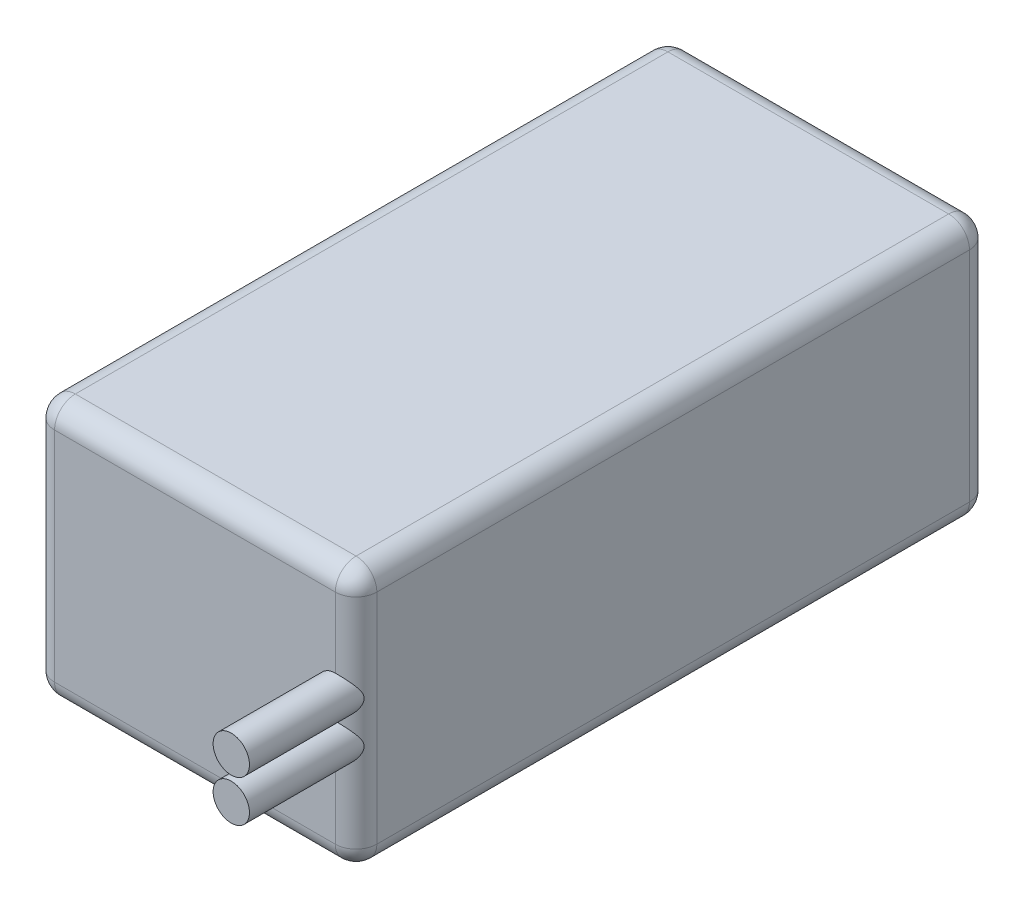
from build123d import *

# Parameters (mm, degrees)
SKETCH1_W           = 31
SKETCH1_H           = 61
BOSS_EXTRUDE1_DEPTH = 25
SKETCH2_R           = 1.75
BOSS_EXTRUDE2_DEPTH = 10
FILLET1_R           = 2


with BuildPart() as part:
    # Sketch1 → Boss-Extrude1 (new body)
    with BuildSketch(Plane(origin=(0, 0, 0), x_dir=(1, 0, 0), z_dir=(0, 1, 0))):
        Rectangle(SKETCH1_W, SKETCH1_H)
    extrude(amount=BOSS_EXTRUDE1_DEPTH)

    # Sketch2 → Boss-Extrude2 (add)
    with BuildSketch(Plane.XY.offset(30.5)):
        with Locations(Location((13.5, 14.5, 0), (0, 0, 180))):
            Circle(SKETCH2_R)
        with Locations((13.5, 10.5)):
            Circle(SKETCH2_R)
    extrude(amount=BOSS_EXTRUDE2_DEPTH)

    # Fillet1
    # the kernel refuses this fillet: 2 mm, written as the material it takes off along each edge
    with BuildSketch(Plane(origin=(-13.5, 23, 28.5), x_dir=(0, 1, 0), z_dir=(-1, 0, 0))) as fillet1_piece_1_section:
        Polygon((0, 0), (FILLET1_R, 0), (FILLET1_R, -FILLET1_R), (0, -FILLET1_R), align=None)
    fillet1_piece_1 = extrude(amount=FILLET1_R, mode=Mode.PRIVATE)
    fillet1_piece_1 = fillet1_piece_1 - Plane(origin=(-13.5, 23, 28.5), x_dir=(0, -0.7071067811865475, -0.7071067811865475), z_dir=(-1, 0, 0)) * Sphere(FILLET1_R, mode=Mode.PRIVATE)
    add(fillet1_piece_1, mode=Mode.SUBTRACT)
    with BuildSketch(Plane(origin=(-13.5, 23, -28.5), x_dir=(-1, 0, 0), z_dir=(0, 0, -1))) as fillet1_piece_2_section:
        Polygon((0, 0), (FILLET1_R, 0), (FILLET1_R, FILLET1_R), (0, FILLET1_R), align=None)
    fillet1_piece_2 = extrude(amount=FILLET1_R, mode=Mode.PRIVATE)
    fillet1_piece_2 = fillet1_piece_2 - Plane(origin=(-13.5, 23, -28.5), x_dir=(0.7071067811865475, -0.7071067811865475, 0), z_dir=(0, 0, -1)) * Sphere(FILLET1_R, mode=Mode.PRIVATE)
    add(fillet1_piece_2, mode=Mode.SUBTRACT)
    with BuildSketch(Plane(origin=(13.5, 23, 28.5), x_dir=(0, 1, 0), z_dir=(1, 0, 0))) as fillet1_piece_3_section:
        Polygon((0, 0), (FILLET1_R, 0), (FILLET1_R, FILLET1_R), (0, FILLET1_R), align=None)
    fillet1_piece_3 = extrude(amount=FILLET1_R, mode=Mode.PRIVATE)
    fillet1_piece_3 = fillet1_piece_3 - Plane(origin=(13.5, 23, 28.5), x_dir=(0, -0.7071067811865475, -0.7071067811865475), z_dir=(1, 0, 0)) * Sphere(FILLET1_R, mode=Mode.PRIVATE)
    add(fillet1_piece_3, mode=Mode.SUBTRACT)
    with BuildSketch(Plane(origin=(13.5, 23, -28.5), x_dir=(1, 0, 0), z_dir=(0, 0, -1))) as fillet1_piece_4_section:
        Polygon((0, 0), (FILLET1_R, 0), (FILLET1_R, -FILLET1_R), (0, -FILLET1_R), align=None)
    fillet1_piece_4 = extrude(amount=FILLET1_R, mode=Mode.PRIVATE)
    fillet1_piece_4 = fillet1_piece_4 - Plane(origin=(13.5, 23, -28.5), x_dir=(-0.7071067811865475, -0.7071067811865475, 0), z_dir=(0, 0, -1)) * Sphere(FILLET1_R, mode=Mode.PRIVATE)
    add(fillet1_piece_4, mode=Mode.SUBTRACT)
    with BuildSketch(Plane(origin=(13.5, 2, 28.5), x_dir=(0, -1, 0), z_dir=(1, 0, 0))) as fillet1_piece_5_section:
        Polygon((0, 0), (FILLET1_R, 0), (FILLET1_R, -FILLET1_R), (0, -FILLET1_R), align=None)
    fillet1_piece_5 = extrude(amount=FILLET1_R, mode=Mode.PRIVATE)
    fillet1_piece_5 = fillet1_piece_5 - Plane(origin=(13.5, 2, 28.5), x_dir=(0, 0.7071067811865475, -0.7071067811865475), z_dir=(1, 0, 0)) * Sphere(FILLET1_R, mode=Mode.PRIVATE)
    add(fillet1_piece_5, mode=Mode.SUBTRACT)
    with BuildSketch(Plane(origin=(-13.5, 2, 28.5), x_dir=(0, -1, 0), z_dir=(-1, 0, 0))) as fillet1_piece_6_section:
        Polygon((0, 0), (FILLET1_R, 0), (FILLET1_R, FILLET1_R), (0, FILLET1_R), align=None)
    fillet1_piece_6 = extrude(amount=FILLET1_R, mode=Mode.PRIVATE)
    fillet1_piece_6 = fillet1_piece_6 - Plane(origin=(-13.5, 2, 28.5), x_dir=(0, 0.7071067811865475, -0.7071067811865475), z_dir=(-1, 0, 0)) * Sphere(FILLET1_R, mode=Mode.PRIVATE)
    add(fillet1_piece_6, mode=Mode.SUBTRACT)
    with BuildSketch(Plane(origin=(-13.5, 2, -28.5), x_dir=(-1, 0, 0), z_dir=(0, 0, -1))) as fillet1_piece_7_section:
        Polygon((0, 0), (FILLET1_R, 0), (FILLET1_R, -FILLET1_R), (0, -FILLET1_R), align=None)
    fillet1_piece_7 = extrude(amount=FILLET1_R, mode=Mode.PRIVATE)
    fillet1_piece_7 = fillet1_piece_7 - Plane(origin=(-13.5, 2, -28.5), x_dir=(0.7071067811865475, 0.7071067811865475, 0), z_dir=(0, 0, -1)) * Sphere(FILLET1_R, mode=Mode.PRIVATE)
    add(fillet1_piece_7, mode=Mode.SUBTRACT)
    with BuildSketch(Plane(origin=(13.5, 2, -28.5), x_dir=(1, 0, 0), z_dir=(0, 0, -1))) as fillet1_piece_8_section:
        Polygon((0, 0), (FILLET1_R, 0), (FILLET1_R, FILLET1_R), (0, FILLET1_R), align=None)
    fillet1_piece_8 = extrude(amount=FILLET1_R, mode=Mode.PRIVATE)
    fillet1_piece_8 = fillet1_piece_8 - Plane(origin=(13.5, 2, -28.5), x_dir=(-0.7071067811865475, 0.7071067811865475, 0), z_dir=(0, 0, -1)) * Sphere(FILLET1_R, mode=Mode.PRIVATE)
    add(fillet1_piece_8, mode=Mode.SUBTRACT)
    with BuildSketch(Plane(origin=(-15.5, 25, 28.5), x_dir=(0, -1, 0), z_dir=(0, 0, -1)), Plane(origin=(15.5, 25, -28.5), x_dir=(0, -1, 0), z_dir=(0, 0, 1))) as fillet1_piece_9:
        with BuildLine():
            CenterArc((FILLET1_R, -FILLET1_R), FILLET1_R, 90, 90)
            Line((0, -FILLET1_R), (0, 0))
            Line((0, 0), (FILLET1_R, 0))
        make_face()
    extrude(amount=57, mode=Mode.SUBTRACT)
    with BuildSketch(Plane(origin=(13.5, 25, 30.5), x_dir=(0, 0, -1), z_dir=(-1, 0, 0)), Plane(origin=(-13.5, 0, -30.5), x_dir=(0, 1, 0), z_dir=(1, 0, 0))) as fillet1_piece_10:
        with BuildLine():
            CenterArc((FILLET1_R, FILLET1_R), FILLET1_R, 180, 90)
            Line((0, FILLET1_R), (0, 0))
            Line((0, 0), (FILLET1_R, 0))
        make_face()
    extrude(amount=27, mode=Mode.SUBTRACT)
    with BuildSketch(Plane(origin=(13.5, 0, 30.5), x_dir=(0, 0, -1), z_dir=(-1, 0, 0)), Plane(origin=(-13.5, 25, -30.5), x_dir=(0, -1, 0), z_dir=(1, 0, 0))) as fillet1_piece_11:
        with BuildLine():
            CenterArc((FILLET1_R, -FILLET1_R), FILLET1_R, 90, 90)
            Line((0, -FILLET1_R), (0, 0))
            Line((0, 0), (FILLET1_R, 0))
        make_face()
    extrude(amount=27, mode=Mode.SUBTRACT)
    with BuildSketch(Plane(origin=(-15.5, 0, 28.5), x_dir=(0, 1, 0), z_dir=(0, 0, -1)), Plane(origin=(15.5, 0, -28.5), x_dir=(0, 1, 0), z_dir=(0, 0, 1))) as fillet1_piece_12:
        with BuildLine():
            CenterArc((FILLET1_R, FILLET1_R), FILLET1_R, 180, 90)
            Line((0, FILLET1_R), (0, 0))
            Line((0, 0), (FILLET1_R, 0))
        make_face()
    extrude(amount=57, mode=Mode.SUBTRACT)
    with BuildSketch(Plane(origin=(15.5, 2, 30.5), x_dir=(0, 0, -1), z_dir=(0, 1, 0))) as fillet1_piece_13_section:
        with BuildLine():
            CenterArc((FILLET1_R, FILLET1_R), FILLET1_R, 180, 90)
            Line((0, FILLET1_R), (0, 0))
            Line((0, 0), (FILLET1_R, 0))
        make_face()
    fillet1_piece_13 = extrude(amount=21, mode=Mode.PRIVATE)
    fillet1_piece_13 = fillet1_piece_13 - Plane(origin=(13.5, 14.5, 30.013488992), x_dir=(-1, 0, 0), z_dir=(0, 0, -1)) * Cylinder(1.75, 50, mode=Mode.PRIVATE)
    fillet1_piece_13 = fillet1_piece_13 - Plane(origin=(13.5, 10.5, 30.013488992), x_dir=(1, 0, 0), z_dir=(0, 0, -1)) * Cylinder(1.75, 50, mode=Mode.PRIVATE)
    add(fillet1_piece_13, mode=Mode.SUBTRACT)
    with BuildSketch(Plane(origin=(-15.5, 2, 30.5), x_dir=(0, 0, -1), z_dir=(0, 1, 0)), Plane(origin=(-15.5, 2, -30.5), x_dir=(1, 0, 0), z_dir=(0, 1, 0))) as fillet1_piece_14:
        with BuildLine():
            CenterArc((FILLET1_R, -FILLET1_R), FILLET1_R, 90, 90)
            Line((0, -FILLET1_R), (0, 0))
            Line((0, 0), (FILLET1_R, 0))
        make_face()
    extrude(amount=21, mode=Mode.SUBTRACT)
    with BuildSketch(Plane(origin=(15.5, 2, -30.5), x_dir=(-1, 0, 0), z_dir=(0, 1, 0))) as fillet1_piece_15:
        with BuildLine():
            CenterArc((FILLET1_R, FILLET1_R), FILLET1_R, 180, 90)
            Line((0, FILLET1_R), (0, 0))
            Line((0, 0), (FILLET1_R, 0))
        make_face()
    extrude(amount=21, mode=Mode.SUBTRACT)


solid = part.part
